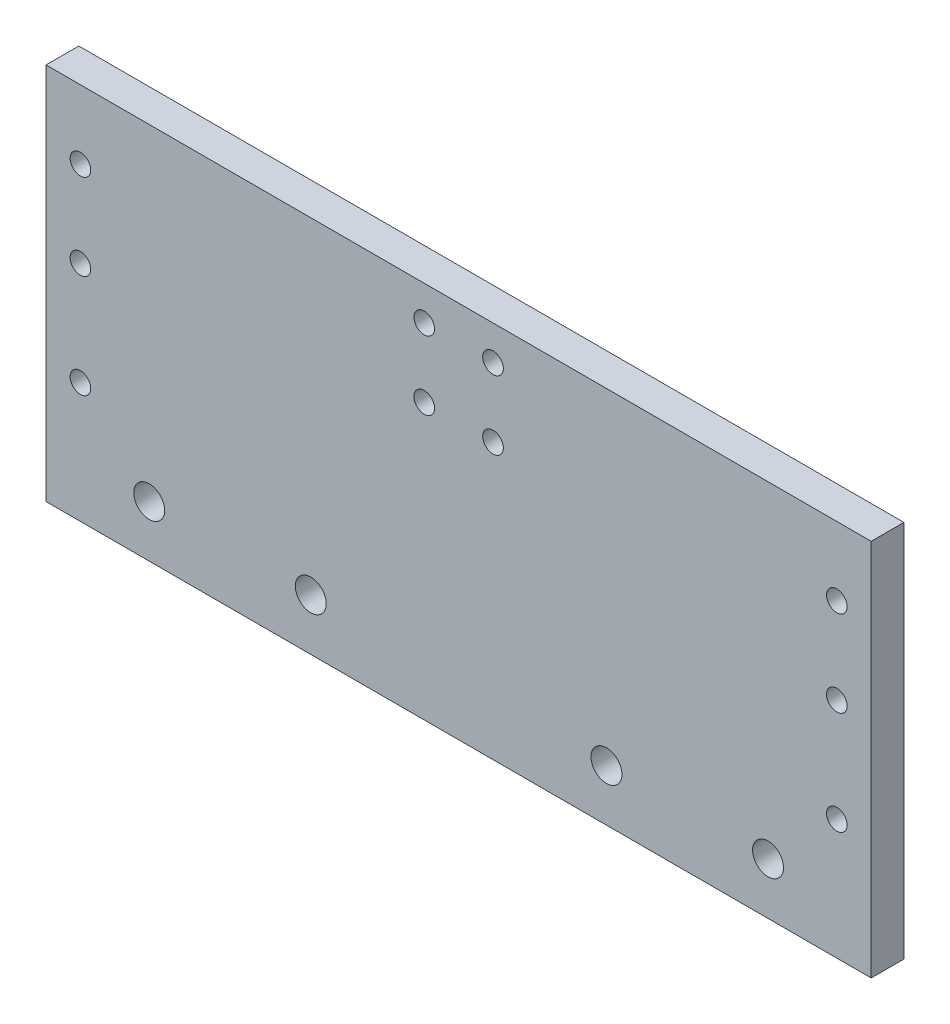
from build123d import *

# Parameters (mm, degrees)
SKETCH1_W           = 120
SKETCH1_H           = 55
BOSS_EXTRUDE1_DEPTH = 4.7625
SKETCH2_R           = 1.5
SKETCH2_R_2         = 2.25
CUT_EXTRUDE1_DEPTH  = 67.173494741


with BuildPart() as part:
    # Sketch1 → Boss-Extrude1 (new body)
    with BuildSketch(Plane.XY):
        Rectangle(SKETCH1_W, SKETCH1_H)
    extrude(amount=BOSS_EXTRUDE1_DEPTH)

    # Sketch2 → Cut-Extrude1 (cut, through all)
    with BuildSketch(Plane.XY.offset(4.7625)):
        with Locations((-55, 17.5)):
            Circle(SKETCH2_R)
        with Locations((-55, 5)):
            Circle(SKETCH2_R)
        with Locations((-55, -10)):
            Circle(SKETCH2_R)
        with Locations((55, -10)):
            Circle(SKETCH2_R)
        with Locations((55, 5)):
            Circle(SKETCH2_R)
        with Locations((55, 17.5)):
            Circle(SKETCH2_R)
        with Locations((-5, 12.5)):
            Circle(SKETCH2_R)
        with Locations((-5, 22.5)):
            Circle(SKETCH2_R)
        with Locations((5, 12.5)):
            Circle(SKETCH2_R)
        with Locations((5, 22.5)):
            Circle(SKETCH2_R)
        with Locations((-45, -20)):
            Circle(SKETCH2_R_2)
        with Locations((-21.5, -20)):
            Circle(SKETCH2_R_2)
        with Locations((45, -20)):
            Circle(SKETCH2_R_2)
        with Locations((21.5, -20)):
            Circle(SKETCH2_R_2)
    extrude(amount=-CUT_EXTRUDE1_DEPTH, mode=Mode.SUBTRACT)


solid = part.part
